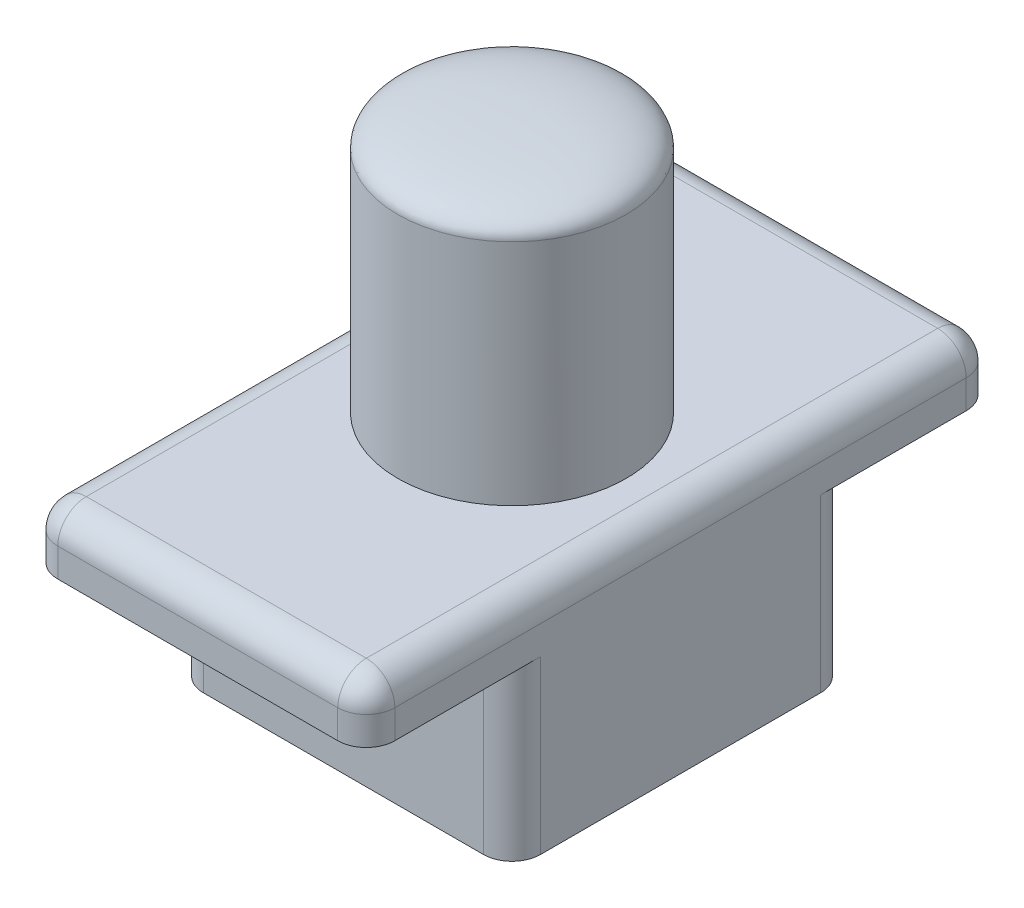
from build123d import *

# Parameters (mm, degrees)
EXTRUDE1_DEPTH     = 2.95
SKETCH2_R          = 2
EXTRUDE2_DEPTH     = 4
FILLET1_R          = 0.5
SKETCH4_W          = 3.9978
SKETCH4_H          = 3.9978
CUT_EXTRUDE1_DEPTH = 2.8
SKETCH5_R          = 0.75
CUT_EXTRUDE2_DEPTH = 0.2


with BuildPart() as part:
    # Sketch1 → Extrude1 (new, symmetric)
    with BuildSketch(Plane(origin=(0, 0, 0), x_dir=(0, 0, -1), z_dir=(1, 0, 0))):
        Polygon((-5.5, 4), (5.5, 4), (5.5, 3), (2.95, 3), (2.95, 0), (-2.95, 0), (-2.95, 3), (-5.5, 3), align=None)
    extrude(amount=EXTRUDE1_DEPTH, both=True)

    # Sketch2 → Extrude2 (add)
    with BuildSketch(Plane(origin=(0, 4, 0), x_dir=(1, 0, 0), z_dir=(0, 1, 0))):
        Circle(SKETCH2_R)
    extrude(amount=EXTRUDE2_DEPTH)

    # Sketch3 → Revolve1 (revolve)
    with BuildSketch(Plane.XY):
        with BuildLine():
            Line((0, 8), (2, 8))
            add(Edge.make_bspline(
                [(0, 8.500000866), (0.210223811, 8.499997809), (0.519523897, 8.493957766), (0.913581685, 8.467562584), (1.197251407, 8.435892924), (1.464866126, 8.388168728), (1.66873988, 8.32926061), (1.812485069, 8.262780863), (1.906735267, 8.199362754), (1.975845014, 8.118373711), (2.000420804, 8.045407195), (2, 8)],
                knots=[0, 0, 0, 0, 0.25, 0.375, 0.5, 0.625, 0.75, 0.8125, 0.875, 0.9375, 0.990999003, 0.990999003, 0.990999003, 0.990999003], degree=3))
            Line((0, 8.500000866), (0, 8))
        make_face()
    revolve(axis=Axis((0, 8, 0), (0, 1, 0)))

    # Fillet1
    fillet1_edges = [part.edges().sort_by_distance(p)[0] for p in [
        (0, 4, 5.5),
        (-2.95, 4, 0),
        (0, 4, -5.5),
        (2.95, 4, 0),
        (-2.95, 1.5, 2.95),
        (-2.95, 1.5, -2.95),
        (2.95, 1.5, -2.95),
        (2.95, 1.5, 2.95),
        (2.95, 3.5, 5.5),
        (-2.95, 3.5, 5.5),
        (-2.95, 3.5, -5.5),
        (2.95, 3.5, -5.5),
    ]]
    fillet(fillet1_edges, radius=FILLET1_R)

    # Sketch4 → Cut-Extrude1 (cut)
    with BuildSketch(Plane.XZ):
        Rectangle(SKETCH4_W, SKETCH4_H)
    extrude(amount=-CUT_EXTRUDE1_DEPTH, mode=Mode.SUBTRACT)

    # Sketch5 → Cut-Extrude2 (cut)
    with BuildSketch(Plane.XZ.offset(-2.8)):
        Circle(SKETCH5_R)
    extrude(amount=-CUT_EXTRUDE2_DEPTH, mode=Mode.SUBTRACT)


solid = part.part
